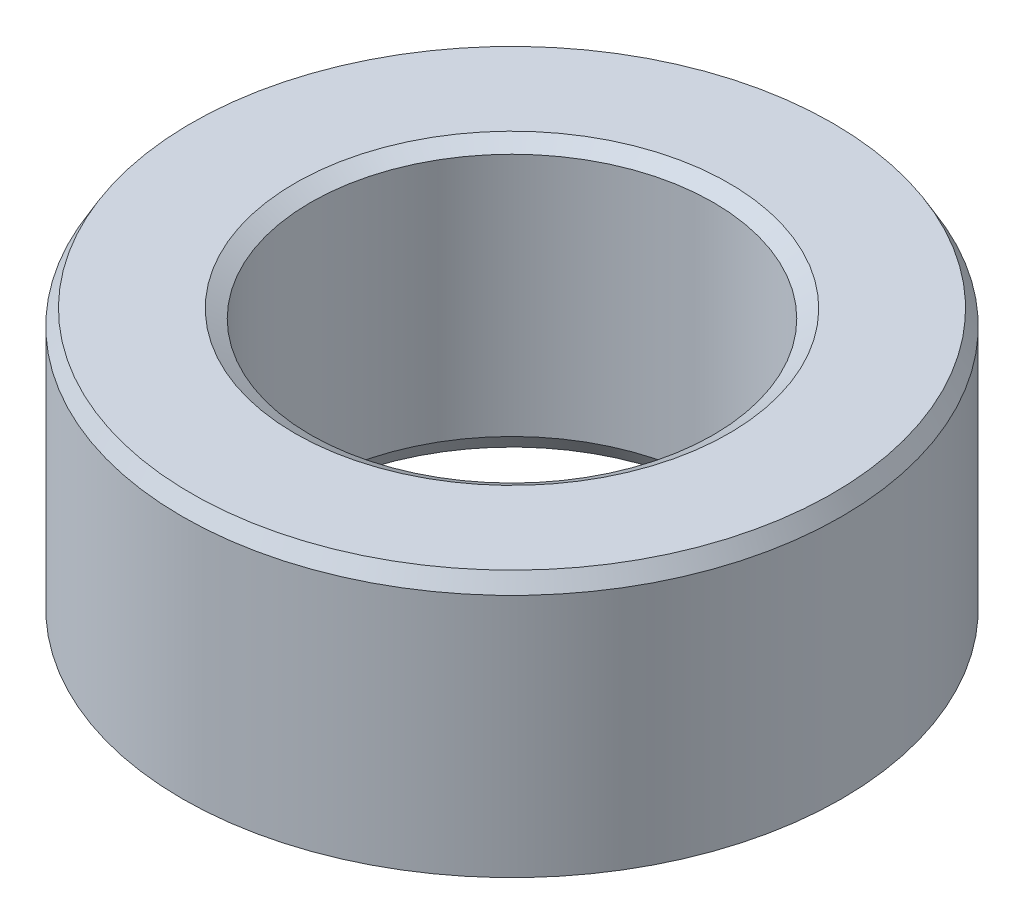
from build123d import *
from OCP.BRepFilletAPI import BRepFilletAPI_MakeChamfer

# Parameters (mm, degrees)
SKETCH1_R           = 57.5
BOSS_EXTRUDE1_DEPTH = 46.900557613
SKETCH2_R           = 35.120129911
CUT_EXTRUDE1_DEPTH  = 94.873118114
CHAMFER1_SIZE       = 2.709128414
CHAMFER1_SIZE2      = 1.564116019


with BuildPart() as part:
    # Sketch1 → Boss-Extrude1 (new body)
    with BuildSketch(Plane(origin=(0, 0, 0), x_dir=(1, 0, 0), z_dir=(0, 1, 0))):
        Circle(SKETCH1_R)
    extrude(amount=BOSS_EXTRUDE1_DEPTH)

    # Sketch2 → Cut-Extrude1 (cut, through all)
    with BuildSketch(Plane(origin=(0, 0, 0), x_dir=(1, 0, 0), z_dir=(0, 1, 0))):
        Circle(SKETCH2_R)
    extrude(amount=CUT_EXTRUDE1_DEPTH, mode=Mode.SUBTRACT)

    # Chamfer1: one chamfer whose edges measure the first distance from different faces: ONE call of the kernel's chamfer builder (chamfer() names one face for all edges)
    chamfer1_edges_1 = [part.edges().sort_by_distance(p)[0] for p in [
        (-35.120129911, 46.900557613, 0),
    ]]
    chamfer1_side_1 = [part.faces().sort_by_distance(p)[0] for p in [
        (-55.873654403, 46.900557613, 0),
    ]]
    chamfer1_edges_2 = [part.edges().sort_by_distance(p)[0] for p in [
        (-35.120129911, 0, 0),
    ]]
    chamfer1_side_2 = [part.faces().sort_by_distance(p)[0] for p in [
        (-35.120129911, 23.450278807, 0),
    ]]
    chamfer1_edges_3 = [part.edges().sort_by_distance(p)[0] for p in [
        (-57.5, 0, 0),
    ]]
    chamfer1_side_3 = [part.faces().sort_by_distance(p)[0] for p in [
        (-55.873654403, 0, 0),
    ]]
    chamfer1_edges_4 = [part.edges().sort_by_distance(p)[0] for p in [
        (-57.5, 46.900557613, 0),
    ]]
    chamfer1_side_4 = [part.faces().sort_by_distance(p)[0] for p in [
        (-57.5, 23.450278807, 0),
    ]]
    chamfer1 = BRepFilletAPI_MakeChamfer(part.part.solid().wrapped)
    for e in chamfer1_edges_1:
        chamfer1.Add(CHAMFER1_SIZE, CHAMFER1_SIZE2, e.wrapped, chamfer1_side_1[0].wrapped)  # the first distance lies on this face
    for e in chamfer1_edges_2:
        chamfer1.Add(CHAMFER1_SIZE, CHAMFER1_SIZE2, e.wrapped, chamfer1_side_2[0].wrapped)  # the first distance lies on this face
    for e in chamfer1_edges_3:
        chamfer1.Add(CHAMFER1_SIZE, CHAMFER1_SIZE2, e.wrapped, chamfer1_side_3[0].wrapped)  # the first distance lies on this face
    for e in chamfer1_edges_4:
        chamfer1.Add(CHAMFER1_SIZE, CHAMFER1_SIZE2, e.wrapped, chamfer1_side_4[0].wrapped)  # the first distance lies on this face
    add(Compound.cast(chamfer1.Shape()), mode=Mode.REPLACE)


solid = part.part
